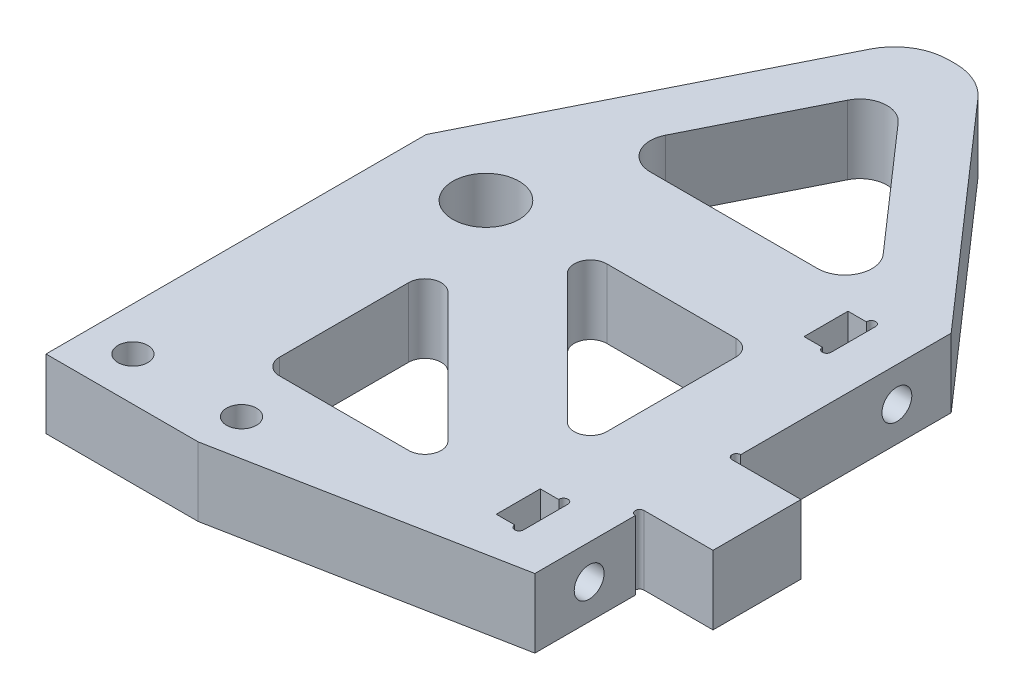
from build123d import *

# Parameters (mm, degrees)
SKETCH1_R           = 6.1
SKETCH1_R_2         = 2.75
BOSS_EXTRUDE1_DEPTH = 12.7
FILLET1_R           = 10
CUT_EXTRUDE1_DEPTH  = 145.780143666
FILLET2_R           = 5
CUT_EXTRUDE2_DEPTH  = 145.780143666
SKETCH6_R           = 2.75
CUT_EXTRUDE3_DEPTH  = 141.517934798


with BuildPart() as part:
    # Sketch1 → Boss-Extrude1 (new body)
    with BuildSketch(Plane(origin=(0, 0, 0), x_dir=(1, 0, 0), z_dir=(0, 1, 0))):
        with BuildLine():
            Line((-80, 0), (-80, 60))
            Line((-80, 60), (-50, 120))
            Line((-50, 120), (-38, 120))
            Line((-38, 120), (0, 76.65))
            Line((0, 76.65), (0, 37.9))
            ThreePointArc((0, 37.9), (-0.8, 37.1), (0, 36.3))
            Line((0, 36.3), (12.7, 36.3))
            Line((12.7, 36.3), (12.7, 20.1))
            Line((12.7, 20.1), (0, 20.1))
            ThreePointArc((0, 20.1), (-0.8, 19.3), (0, 18.5))
            Line((0, 18.5), (0, 0))
            Line((0, 0), (-52, -10))
            Line((-52, -10), (-80, -10))
            Line((-80, -10), (-80, 0))
        make_face()
        with Locations((-64, 55)):
            Circle(SKETCH1_R, mode=Mode.SUBTRACT)
        with Locations((-72, -2)):
            Circle(SKETCH1_R_2, mode=Mode.SUBTRACT)
        with Locations((-52, -2)):
            Circle(SKETCH1_R_2, mode=Mode.SUBTRACT)
    extrude(amount=BOSS_EXTRUDE1_DEPTH)

    # Fillet1
    fillet1_edges = [part.edges().sort_by_distance(p)[0] for p in [
        (-38, 6.35, -120),
        (-50, 6.35, -120),
    ]]
    fillet(fillet1_edges, radius=FILLET1_R)

    # Sketch3 → Cut-Extrude1 (cut, through all)
    with BuildSketch(Plane(origin=(0, 12.7, 0), x_dir=(1, 0, 0), z_dir=(0, 1, 0))):
        Polygon((-11.544959177, 74.65), (-43.352058223, 110.93520378), (-61.494660113, 74.65), align=None)
        with BuildLine():
            Line((-58, 34.757359313), (-58, 11))
            ThreePointArc((-58, 11), (-57.121320344, 8.878679656), (-55, 8))
            Line((-55, 8), (-31.242640687, 8))
            ThreePointArc((-31.242640687, 8), (-28.47100209, 9.851949703), (-29.121320344, 13.121320344))
            Line((-29.121320344, 13.121320344), (-52.878679656, 36.878679656))
            ThreePointArc((-52.878679656, 36.878679656), (-56.148050297, 37.52899791), (-58, 34.757359313))
        make_face()
        with BuildLine():
            Line((-16, 29.242640687), (-16, 53))
            ThreePointArc((-16, 53), (-16.878679656, 55.121320344), (-19, 56))
            Line((-19, 56), (-42.757359313, 56))
            ThreePointArc((-42.757359313, 56), (-45.52899791, 54.148050297), (-44.878679656, 50.878679656))
            Line((-44.878679656, 50.878679656), (-21.121320344, 27.121320344))
            ThreePointArc((-21.121320344, 27.121320344), (-17.851949703, 26.47100209), (-16, 29.242640687))
        make_face()
    extrude(amount=-CUT_EXTRUDE1_DEPTH, mode=Mode.SUBTRACT)

    # Fillet2
    fillet2_edges = [part.edges().sort_by_distance(p)[0] for p in [
        (-43.352058223, 6.35, -110.93520378),
        (-11.544959177, 6.35, -74.65),
        (-61.494660113, 6.35, -74.65),
    ]]
    fillet(fillet2_edges, radius=FILLET2_R)

    # Sketch4 → Cut-Extrude2 (cut, through all)
    with BuildSketch(Plane(origin=(0, 12.7, 0), x_dir=(1, 0, 0), z_dir=(0, 1, 0))):
        with BuildLine():
            Line((-13, 14), (-13, 5.9))
            Line((-13, 5.9), (-9.6, 5.9))
            ThreePointArc((-9.6, 5.9), (-8.8, 5.1), (-8, 5.9))
            Line((-8, 5.9), (-8, 14.1))
            ThreePointArc((-8, 14.1), (-8.85009833, 14.898429807), (-9.593725393, 14))
            Line((-9.593725393, 14), (-13, 14))
        make_face()
        with BuildLine():
            Line((-13, 62.55), (-9.6, 62.55))
            ThreePointArc((-9.6, 62.55), (-8.8, 61.75), (-8, 62.55))
            Line((-8, 62.55), (-8, 70.75))
            ThreePointArc((-8, 70.75), (-8.85009833, 71.548429807), (-9.593725393, 70.65))
            Line((-9.593725393, 70.65), (-13, 70.65))
            Line((-13, 70.65), (-13, 62.55))
        make_face()
    extrude(amount=-CUT_EXTRUDE2_DEPTH, mode=Mode.SUBTRACT)

    # Sketch6 → Cut-Extrude3 (cut, through all)
    with BuildSketch(Plane.ZY.offset(8)):
        with Locations((-10, 6.35)):
            Circle(SKETCH6_R)
        with Locations((-66.65, 6.35)):
            Circle(SKETCH6_R)
    extrude(amount=-CUT_EXTRUDE3_DEPTH, mode=Mode.SUBTRACT)


solid = part.part
